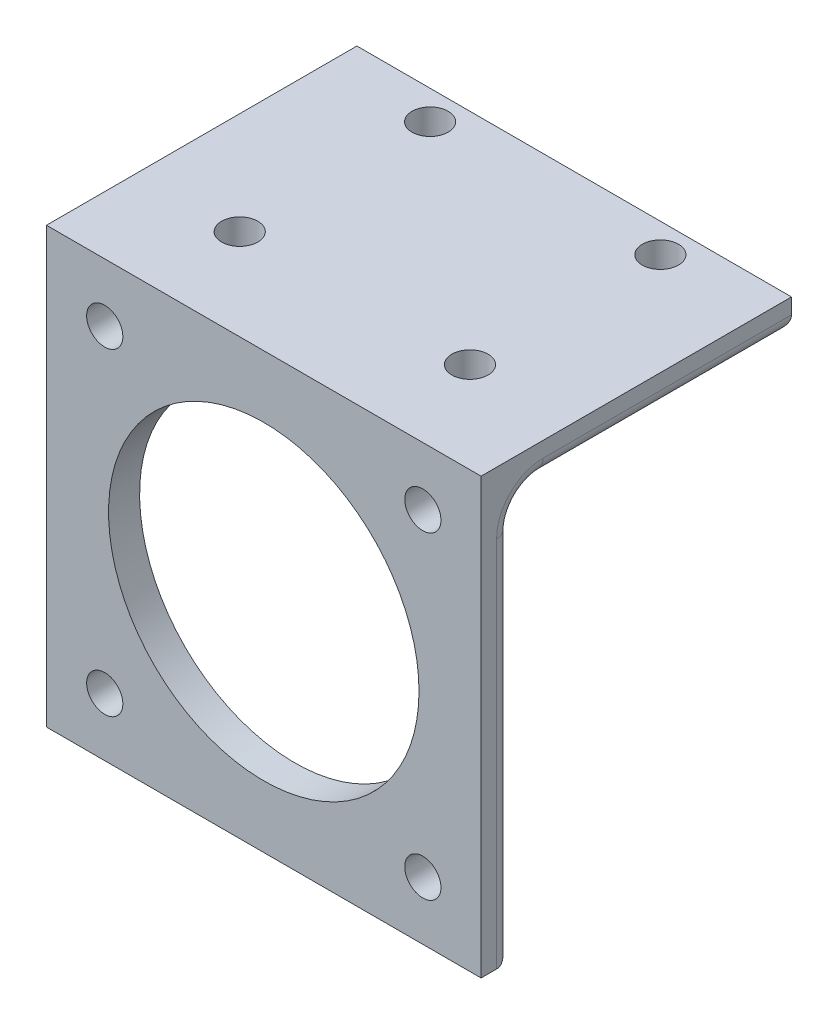
from build123d import *

# Parameters (mm, degrees)
ESQUISSE1_W             = 42
ESQUISSE1_H             = 42
BOSS_EXTRU_1_DEPTH      = 3
ESQUISSE2_R             = 15
ESQUISSE2_R_2           = 1.75
ENL_V_MAT_EXTRU_1_DEPTH = 3
ESQUISSE5_W             = 42
ESQUISSE5_H             = 30
BOSS_EXTRU_2_DEPTH      = 3
CONG_1_R                = 3
ESQUISSE6_R             = 3
ENL_V_MAT_EXTRU_2_DEPTH = 66.245689577
ESQUISSE7_R             = 1.75
ENL_V_MAT_EXTRU_3_DEPTH = 3
CONG_2_R                = 1.5


with BuildPart() as part:
    # Esquisse1 → Boss.-Extru.1 (new body)
    with BuildSketch(Plane.XY):
        with Locations((-21, 21)):
            Rectangle(ESQUISSE1_W, ESQUISSE1_H)
    extrude(amount=BOSS_EXTRU_1_DEPTH)

    # Esquisse2 → Enlèv. mat.-Extru.1 (cut)
    with BuildSketch(Plane.XY.offset(3)):
        with Locations((-21, 21)):
            Circle(ESQUISSE2_R)
        with Locations((-36.37, 36.37)):
            Circle(ESQUISSE2_R_2)
        with Locations((-36.37, 5.63)):
            Circle(ESQUISSE2_R_2)
        with Locations((-5.63, 5.63)):
            Circle(ESQUISSE2_R_2)
        with Locations((-5.63, 36.37)):
            Circle(ESQUISSE2_R_2)
    extrude(amount=-ENL_V_MAT_EXTRU_1_DEPTH, mode=Mode.SUBTRACT)

    # Esquisse5 → Boss.-Extru.2 (add)
    with BuildSketch(Plane(origin=(0, 42, 0), x_dir=(1, 0, 0), z_dir=(0, 1, 0))):
        with Locations((-21, 12)):
            Rectangle(ESQUISSE5_W, ESQUISSE5_H)
    extrude(amount=-BOSS_EXTRU_2_DEPTH)

    # Congé1
    # the kernel refuses this fillet: 3 mm, written as the material it adds along each edge
    with BuildSketch(Plane(origin=(-42, 39, 0), x_dir=(0, -1, 0), z_dir=(1, 0, 0))) as cong_1_piece_1_section:
        with BuildLine():
            CenterArc((CONG_1_R, CONG_1_R), CONG_1_R, 180, 90)
            Line((0, CONG_1_R), (0, 0))
            Line((0, 0), (CONG_1_R, 0))
        make_face()
    cong_1_piece_1 = extrude(amount=42, mode=Mode.PRIVATE)
    cong_1_piece_1 = cong_1_piece_1 - Plane(origin=(-5.63, 36.37, -0.697446151), x_dir=(1, 0, 0), z_dir=(0, 0, 1)) * Cylinder(1.75, 96, mode=Mode.PRIVATE)
    cong_1_piece_1 = cong_1_piece_1 - Plane(origin=(-36.37, 36.37, -0.697446151), x_dir=(1, 0, 0), z_dir=(0, 0, 1)) * Cylinder(1.75, 96, mode=Mode.PRIVATE)
    add(cong_1_piece_1)

    # Esquisse6 → Enlèv. mat.-Extru.2 (cut, through all)
    with BuildSketch(Plane(origin=(0, 0, 0), x_dir=(-1, 0, 0), z_dir=(0, 0, -1))):
        with Locations((36.37, 36.37)):
            Circle(ESQUISSE6_R)
        with Locations((5.63, 36.37)):
            Circle(ESQUISSE6_R)
    extrude(amount=ENL_V_MAT_EXTRU_2_DEPTH, mode=Mode.SUBTRACT)

    # Esquisse7 → Enlèv. mat.-Extru.3 (cut)
    with BuildSketch(Plane.XZ.offset(-39)):
        with Locations(Location((-32.126705158, -5.8, 0), (0, 0, 270))):
            Circle(ESQUISSE7_R)
        with Locations(Location((-9.873294842, -5.8, 0), (0, 0, 90))):
            Circle(ESQUISSE7_R)
        with Locations(Location((-9.873294842, -24.2, 0), (0, 0, 270))):
            Circle(ESQUISSE7_R)
        with Locations(Location((-32.126705158, -24.2, 0), (0, 0, 90))):
            Circle(ESQUISSE7_R)
    extrude(amount=-ENL_V_MAT_EXTRU_3_DEPTH, mode=Mode.SUBTRACT)

    # Congé2
    # the kernel refuses this fillet: 1.5 mm, written as the material it takes off along each edge
    with BuildSketch(Plane(origin=(-42, 39, -30.75), x_dir=(0, 1, 0), z_dir=(0, 0, 1)), Plane(origin=(0, 39, -3), x_dir=(0, 1, 0), z_dir=(0, 0, -1))) as cong_2_piece_1:
        with BuildLine():
            CenterArc((CONG_2_R, -CONG_2_R), CONG_2_R, 90, 90)
            Line((0, -CONG_2_R), (0, 0))
            Line((0, 0), (CONG_2_R, 0))
        make_face()
    extrude(amount=27.75, mode=Mode.SUBTRACT)
    with BuildSketch(Plane(origin=(3.75, 39, -27), x_dir=(0, 1, 0), z_dir=(-1, 0, 0))) as cong_2_piece_2:
        with BuildLine():
            CenterArc((CONG_2_R, -CONG_2_R), CONG_2_R, 90, 90)
            Line((0, -CONG_2_R), (0, 0))
            Line((0, 0), (CONG_2_R, 0))
        make_face()
    extrude(amount=11.686705158, mode=Mode.SUBTRACT)
    with BuildSketch(Plane(origin=(0, 36, 0), x_dir=(-1, 0, 0), z_dir=(0, -1, 0))) as cong_2_piece_3:
        with BuildLine():
            CenterArc((CONG_2_R, -CONG_2_R), CONG_2_R, 90, 90)
            Line((0, -CONG_2_R), (0, 0))
            Line((0, 0), (CONG_2_R, 0))
        make_face()
    extrude(amount=39.75, mode=Mode.SUBTRACT)
    with BuildSketch(Plane(origin=(3.75, 0, 0), x_dir=(0, 1, 0), z_dir=(-1, 0, 0))) as cong_2_piece_4:
        with BuildLine():
            CenterArc((CONG_2_R, -CONG_2_R), CONG_2_R, 90, 90)
            Line((0, -CONG_2_R), (0, 0))
            Line((0, 0), (CONG_2_R, 0))
        make_face()
    extrude(amount=49.5, mode=Mode.SUBTRACT)
    with BuildSketch(Plane(origin=(-42, -3.75, 0), x_dir=(0, 0, 1), z_dir=(0, 1, 0))) as cong_2_piece_5:
        with BuildLine():
            CenterArc((CONG_2_R, CONG_2_R), CONG_2_R, 180, 90)
            Line((0, CONG_2_R), (0, 0))
            Line((0, 0), (CONG_2_R, 0))
        make_face()
    extrude(amount=39.75, mode=Mode.SUBTRACT)
    with BuildSketch(Plane(origin=(0, 36, -3), x_dir=(0, 1, 0), z_dir=(0, 0, -1))) as cong_2_piece_6:
        with BuildLine():
            CenterArc((3 + CONG_2_R, -CONG_2_R), CONG_2_R, 90, 90)
            Line((3 + CONG_2_R, 0), (3, 0))
            Line((3, 0), (3, -CONG_2_R))
        make_face()
    revolve(axis=Axis((0, 36, -3), (1, 0, 0)), revolution_arc=90, mode=Mode.SUBTRACT)
    with BuildSketch(Plane(origin=(-42, 36, -3), x_dir=(0, 1, 0), z_dir=(0, 0, -1))) as cong_2_piece_7:
        with BuildLine():
            CenterArc((3 + CONG_2_R, CONG_2_R), CONG_2_R, 180, 90)
            Line((3 + CONG_2_R, 0), (3, 0))
            Line((3, 0), (3, CONG_2_R))
        make_face()
    revolve(axis=Axis((-42, 36, -3), (1, 0, 0)), revolution_arc=90, mode=Mode.SUBTRACT)
    with BuildSketch(Plane(origin=(-3.323294842, 39, -27), x_dir=(0, 1, 0), z_dir=(-1, 0, 0))) as cong_2_piece_8:
        with BuildLine():
            CenterArc((CONG_2_R, -CONG_2_R), CONG_2_R, 90, 90)
            Line((0, -CONG_2_R), (0, 0))
            Line((0, 0), (CONG_2_R, 0))
        make_face()
    extrude(amount=35.353410317, mode=Mode.SUBTRACT)
    with BuildSketch(Plane(origin=(-34.063294842, 39, -27), x_dir=(0, 0, 1), z_dir=(-1, 0, 0))) as cong_2_piece_9:
        with BuildLine():
            CenterArc((CONG_2_R, CONG_2_R), CONG_2_R, 180, 90)
            Line((0, CONG_2_R), (0, 0))
            Line((0, 0), (CONG_2_R, 0))
        make_face()
    extrude(amount=11.686705158, mode=Mode.SUBTRACT)


solid = part.part
